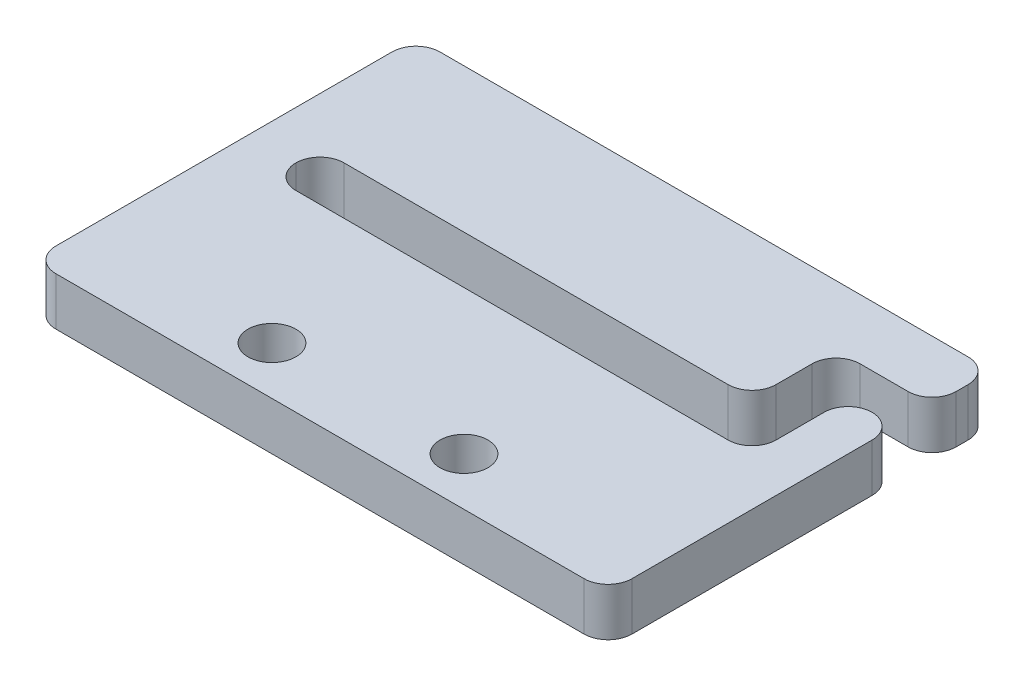
from build123d import *

# Parameters (mm, degrees)
SKETCH1_R           = 3.175
BOSS_EXTRUDE1_DEPTH = 6.35
FILLET1_R           = 3.175
FILLET2_R           = 3.175
FILLET3_R           = 3.175
FILLET4_R           = 3.175


with BuildPart() as part:
    # Sketch1 → Boss-Extrude1 (new body)
    with BuildSketch(Plane(origin=(0, 0, 0), x_dir=(1, 0, 0), z_dir=(0, 1, 0))):
        Polygon((63.5, -7.9375), (76.2, -7.9375), (76.2, 0), (0, 0), (0, -50.8), (76.2, -50.8), (76.2, -12.7), (69.85, -12.7), (69.85, -25.4), (6.35, -25.4), (6.35, -19.05), (63.5, -19.05), align=None)
        with Locations(Location((25.4, -44.45, 0), (0, 0, 270))):
            Circle(SKETCH1_R, mode=Mode.SUBTRACT)
        with Locations(Location((50.8, -44.45, 0), (0, 0, 270))):
            Circle(SKETCH1_R, mode=Mode.SUBTRACT)
    extrude(amount=BOSS_EXTRUDE1_DEPTH)

    # Fillet1
    fillet1_edges = [part.edges().sort_by_distance(p)[0] for p in [
        (6.35, 3.175, 19.05),
        (6.35, 3.175, 25.4),
    ]]
    fillet(fillet1_edges, radius=FILLET1_R - 0.0001)  # a hair under: the kernel refuses the full size

    # Fillet2
    fillet2_edges = [part.edges().sort_by_distance(p)[0] for p in [
        (76.2, 3.175, 50.8),
        (0, 3.175, 50.8),
        (0, 3.175, 0),
        (76.2, 3.175, 0),
    ]]
    fillet(fillet2_edges, radius=FILLET2_R)

    # Fillet3
    fillet3_edges = [part.edges().sort_by_distance(p)[0] for p in [
        (76.2, 3.175, 12.7),
        (76.2, 3.175, 7.9375),
        (63.5, 3.175, 7.9375),
        (63.5, 3.175, 19.05),
        (69.85, 3.175, 25.4),
    ]]
    fillet(fillet3_edges, radius=FILLET3_R)

    # Fillet4
    fillet4_edges = [part.edges().sort_by_distance(p)[0] for p in [
        (69.85, 3.175, 12.7),
    ]]
    fillet(fillet4_edges, radius=FILLET4_R - 0.0001)  # a hair under: the kernel refuses the full size


solid = part.part
